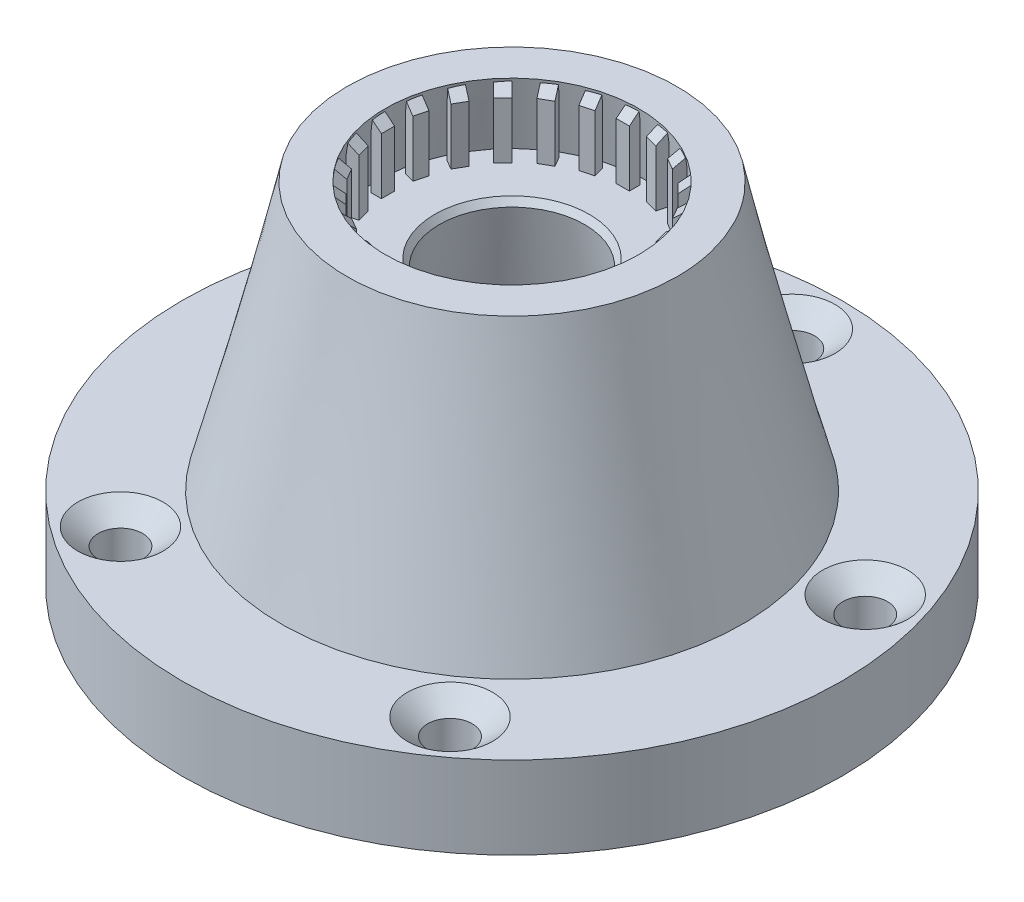
from build123d import *

# Parameters (mm, degrees)
SKETCH3_R                                           = 100
BOSS_EXTRUDE1_DEPTH                                 = 25
BOSS_EXTRUDE2_DEPTH                                 = 4
CIRPATTERN1_COUNT                                   = 24
CHAMFER2_SIZE                                       = 2
CHAMFER2_SIZE2                                      = 1.738949534
CSK_FOR_1_2_FLAT_HEAD_MACHINE_SCREW_100_D           = 13.49248
CSK_FOR_1_2_FLAT_HEAD_MACHINE_SCREW_100_CSINK_D     = 25.8318
CSK_FOR_1_2_FLAT_HEAD_MACHINE_SCREW_100_CSINK_ANGLE = 100


with BuildPart() as part:
    # Sketch3 → Boss-Extrude1 (new body)
    with BuildSketch(Plane(origin=(0, 0, 0), x_dir=(1, 0, 0), z_dir=(0, 1, 0))):
        with Locations(Location((0, 0, 0), (0, 0, 270))):
            Circle(SKETCH3_R)
    extrude(amount=BOSS_EXTRUDE1_DEPTH)

    # Loft1: read off the stored shape, not the designer's step
    # Loft1: loft between two sections, ruled curve by curve
    loft1_from = [
        Edge.make_bspline([(-46.915001275, 106.1953757, 17.291114925), (-81.497231125, 106.1953757, -76.538887625), (12.332771425, 106.1953757, -111.121117475), (46.915001275, 106.1953757, -17.291114925), (81.497231125, 106.1953757, 76.538887625), (-12.332771425, 106.1953757, 111.121117475), (-46.915001275, 106.1953757, 17.291114925)], [0, 0, 0, 0, 0.5, 0.5, 0.5, 1, 1, 1, 1], 3, [1, 0.333333333, 0.333333333, 1, 0.333333333, 0.333333333, 1]),
    ]
    loft1_to = [
        Edge.make_bspline([(-57.432393425, 25, 40.018997807), (-137.470389039, 25, -74.845789042), (-22.60560219, 25, -154.883784657), (57.432393425, 25, -40.018997807), (137.470389039, 25, 74.845789042), (22.60560219, 25, 154.883784657), (-57.432393425, 25, 40.018997807)], [0, 0, 0, 0, 0.5, 0.5, 0.5, 1, 1, 1, 1], 3, [1, 0.333333333, 0.333333333, 1, 0.333333333, 0.333333333, 1]),
    ]
    loft1 = Solid(Shell([*[Face.make_surface_from_curves(loft1_from[k], loft1_to[k]) for k in range(1)], Face(Wire(loft1_from)), Face(Wire(loft1_to))]))
    add(loft1)

    # Sketch7 → Cut-Revolve1 (revolve, cut)
    with BuildSketch(Plane.XY, mode=Mode.PRIVATE) as cut_revolve1_sk:
        Polygon((-40.958551386, 85.896531775), (-38.425878739, 106.1953757), (0, 106.1953757), (0, 85.896531775), align=None)
    revolve(cut_revolve1_sk.sketch.rotate(Axis((0, 25, 0), (0, 1, 0)), 180), axis=Axis((0, 25, 0), (0, 1, 0)), mode=Mode.SUBTRACT)

    # Sketch9 → Cut-Revolve3 (revolve, cut)
    with BuildSketch(Plane.XY, mode=Mode.PRIVATE) as cut_revolve3_sk:
        Polygon((0, 85.896531775), (0, 25), (0, -8.211781643), (-35.93101212, -8.211781643), (-35.93101212, 0), (-31.785376286, 25), (-21.687182515, 85.896531775), align=None)
    revolve(cut_revolve3_sk.sketch.rotate(Axis((0, 25, 0), (0, 1, 0)), 180), axis=Axis((0, 25, 0), (0, 1, 0)), mode=Mode.SUBTRACT)

    # Sketch10 → Boss-Extrude2 (add)
    with BuildSketch(Plane.XY):
        Polygon((-38.810309744, 85.896531775), (-35.596371696, 85.896531775), (-35.596371696, 102.973409595), (-38.810309744, 105.564865348), align=None)
    boss_extrude2 = extrude(amount=BOSS_EXTRUDE2_DEPTH)

    # CirPattern1: Boss-Extrude2 ×24 about axis
    cirpattern1_axis = Axis((0, 0, 0), (0, 1, 0))
    for i in range(1, CIRPATTERN1_COUNT):
        add(boss_extrude2.rotate(cirpattern1_axis, i * 360 / CIRPATTERN1_COUNT))

    # Chamfer2
    chamfer2_edges = [part.edges().sort_by_distance(p)[0] for p in [
        (-21.687182515, 85.896531775, 0),
    ]]
    chamfer2_side = [part.faces().sort_by_distance(p)[0] for p in [
        (-28.809097318, 42.948265887, 0),
    ]]
    chamfer(chamfer2_edges, length=CHAMFER2_SIZE, length2=CHAMFER2_SIZE2, reference=chamfer2_side[0])

    # CSK for 1/2 Flat Head Machine Screw (100)1 (through all)
    with Locations(Plane(origin=(0, 25, 0), x_dir=(1, 0, 0), z_dir=(0, 1, 0))):
        with Locations((0, 0), (0, 85), (80.839803885, 26.266444522), (49.961746445, -68.766444522), (-49.961746445, -68.766444522), (-80.839803885, 26.266444522)):
            CounterSinkHole(CSK_FOR_1_2_FLAT_HEAD_MACHINE_SCREW_100_D / 2, CSK_FOR_1_2_FLAT_HEAD_MACHINE_SCREW_100_CSINK_D / 2, counter_sink_angle=CSK_FOR_1_2_FLAT_HEAD_MACHINE_SCREW_100_CSINK_ANGLE)


solid = part.part
